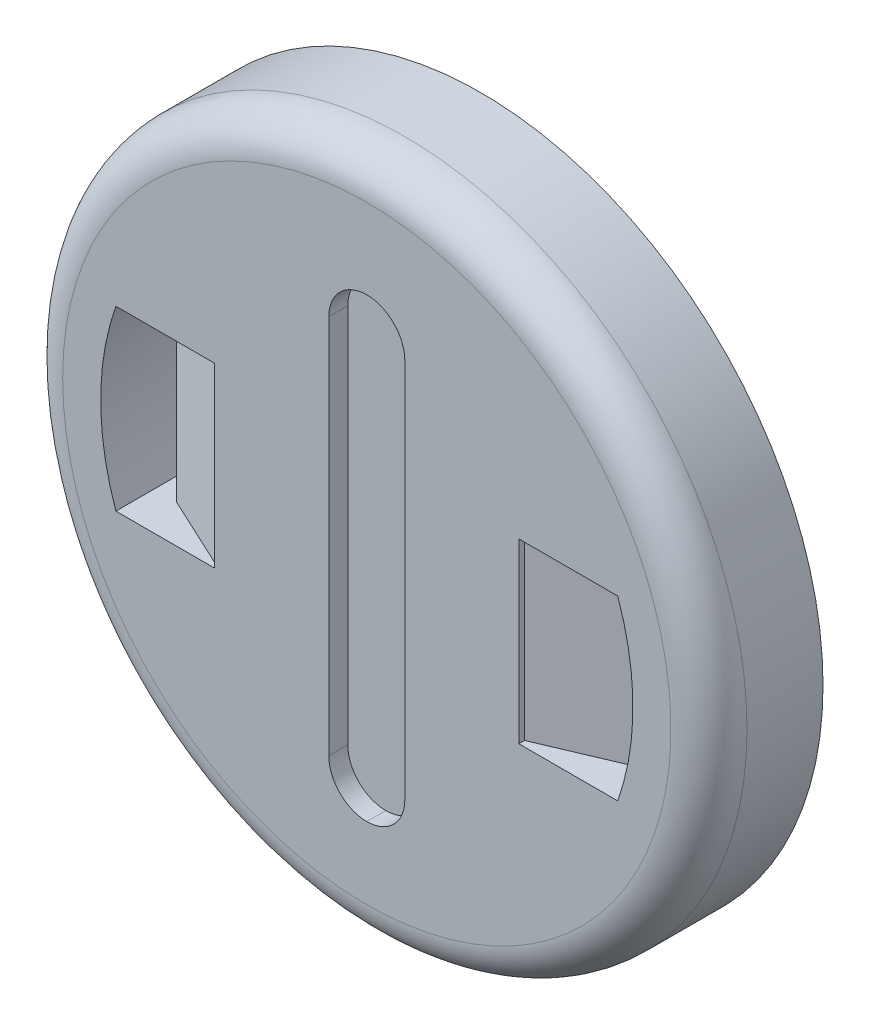
from build123d import *

# Parameters (mm, degrees)
SKETCH_1_R          = 9
EXTRUDE_1_DEPTH     = 3
FILLET_1_R          = 1
SKETCH_3_W          = 2
SKETCH_3_H          = 12
CUT_EXTRUDE_1_DEPTH = 0.5
FILLET_2_R          = 1
CUT_EXTRUDE_2_DEPTH = 1
CHAMFER_2_SIZE      = 2
CHAMFER_2_SIZE2     = 0.932615316
CHAMFER_5_SIZE      = 2
CHAMFER_5_SIZE2     = 0.848949632
CUT_EXTRUDE_3_DEPTH = 8
CUT_EXTRUDE_START   = -2
SKETCH_7_R          = 7
CUT_EXTRUDE_4_DEPTH = 2
EXTRUDE_2_DEPTH     = 2
SKETCH_9_R          = 8
CUT_EXTRUDE_5_DEPTH = 0.5


with BuildPart() as part:
    # 草图1 → 凸台-拉伸1 (new body)
    with BuildSketch(Plane(origin=(0, 0, 12), x_dir=(-1, 0, 0), z_dir=(0, 0, -1))):
        Circle(SKETCH_1_R)
    extrude(amount=-EXTRUDE_1_DEPTH)

    # 圆角1
    fillet_1_edges = [part.edges().sort_by_distance(p)[0] for p in [
        (9, 0, 15),
    ]]
    fillet(fillet_1_edges, radius=FILLET_1_R)

    # 草图3 → 切除-拉伸1 (cut)
    with BuildSketch(Plane.XY.offset(15)):
        with Locations((0, -0.105406486)):
            Rectangle(SKETCH_3_W, SKETCH_3_H)
    extrude(amount=-CUT_EXTRUDE_1_DEPTH, mode=Mode.SUBTRACT)

    # 圆角2
    fillet_2_edges = [part.edges().sort_by_distance(p)[0] for p in [
        (1, -6.105406486, 14.75),
        (-1, -6.105406486, 14.75),
        (1, 5.894593514, 14.75),
        (-1, 5.894593514, 14.75),
    ]]
    fillet(fillet_2_edges, radius=FILLET_2_R - 0.0001)  # a hair under: the kernel refuses the full size

    # 草图4 → 切除-拉伸2 (cut)
    with BuildSketch(Plane.XY.offset(15)):
        with BuildLine():
            Line((-6.599663291, 2.333333333), (-4, 2.333333333))
            Line((-4, 2.333333333), (-4, -2.333333333))
            Line((-4, -2.333333333), (-6.599663291, -2.333333333))
            ThreePointArc((-6.599663291, -2.333333333), (-7, 0), (-6.599663291, 2.333333333))
        make_face()
        with BuildLine():
            Line((4, -2.333333333), (6.599663291, -2.333333333))
            ThreePointArc((6.599663291, -2.333333333), (7, 0), (6.599663291, 2.333333333))
            Line((6.599663291, 2.333333333), (4, 2.333333333))
            Line((4, 2.333333333), (4, -2.333333333))
        make_face()
    extrude(amount=-CUT_EXTRUDE_2_DEPTH, mode=Mode.SUBTRACT)

    # 倒角2
    chamfer_2_edges = [part.edges().sort_by_distance(p)[0] for p in [
        (-4, 0, 14),
    ]]
    chamfer_2_side = [part.faces().sort_by_distance(p)[0] for p in [
        (-5.436521823, 0, 14),
    ]]
    chamfer(chamfer_2_edges, length=CHAMFER_2_SIZE, length2=CHAMFER_2_SIZE2, reference=chamfer_2_side[0])

    # 倒角5
    chamfer_5_edges = [part.edges().sort_by_distance(p)[0] for p in [
        (4, 0, 14),
    ]]
    chamfer_5_side = [part.faces().sort_by_distance(p)[0] for p in [
        (5.436521823, 0, 14),
    ]]
    chamfer(chamfer_5_edges, length=CHAMFER_5_SIZE, length2=CHAMFER_5_SIZE2, reference=chamfer_5_side[0])

    # 草图6 → 切除-拉伸3 (cut)
    with BuildSketch(Plane.XY.offset(14)):
        with BuildLine():
            Line((-6.599663291, -2.333333333), (-6, -2.333333333))
            Line((-6, -2.333333333), (-6, 2.333333333))
            Line((-6, 2.333333333), (-6.599663291, 2.333333333))
            ThreePointArc((-6.599663291, 2.333333333), (-7, 0), (-6.599663291, -2.333333333))
        make_face()
        with BuildLine():
            Line((6.599663291, 2.333333333), (6, 2.333333333))
            Line((6, 2.333333333), (6, -2.333333333))
            Line((6, -2.333333333), (6.599663291, -2.333333333))
            ThreePointArc((6.599663291, -2.333333333), (7, 0), (6.599663291, 2.333333333))
        make_face()
    extrude(amount=-CUT_EXTRUDE_3_DEPTH, mode=Mode.SUBTRACT)

    # 草图7 → 切除-拉伸4 (cut)
    with BuildSketch(Plane(origin=(0, 0, 12), x_dir=(-1, 0, 0), z_dir=(0, 0, -1)).offset(CUT_EXTRUDE_START)):
        with Locations(Location((0, 0, 0), (0, 0, 199.471220634))):
            Circle(SKETCH_7_R)
    extrude(amount=CUT_EXTRUDE_4_DEPTH, mode=Mode.SUBTRACT)

    # 草图8 → 凸台-拉伸2 (add)
    with BuildSketch(Plane(origin=(0, 0, 14), x_dir=(-1, 0, 0), z_dir=(0, 0, -1))):
        with BuildLine():
            Line((-6.599663291, 2.333333333), (-6, 2.333333333))
            Line((-6, 2.333333333), (-6, -2.333333333))
            Line((-6, -2.333333333), (-6.599663291, -2.333333333))
            ThreePointArc((-6.599663291, -2.333333333), (0, -7), (6.599663291, -2.333333333))
            Line((6.599663291, -2.333333333), (6, -2.333333333))
            Line((6, -2.333333333), (6, 2.333333333))
            Line((6, 2.333333333), (6.599663291, 2.333333333))
            ThreePointArc((6.599663291, 2.333333333), (0, 7), (-6.599663291, 2.333333333))
        make_face()
    extrude(amount=EXTRUDE_2_DEPTH)

    # 草图9 → 切除-拉伸5 (cut)
    with BuildSketch(Plane(origin=(0, 0, 12), x_dir=(-1, 0, 0), z_dir=(0, 0, -1))):
        Circle(SKETCH_9_R)
    extrude(amount=-CUT_EXTRUDE_5_DEPTH, mode=Mode.SUBTRACT)


solid = part.part
